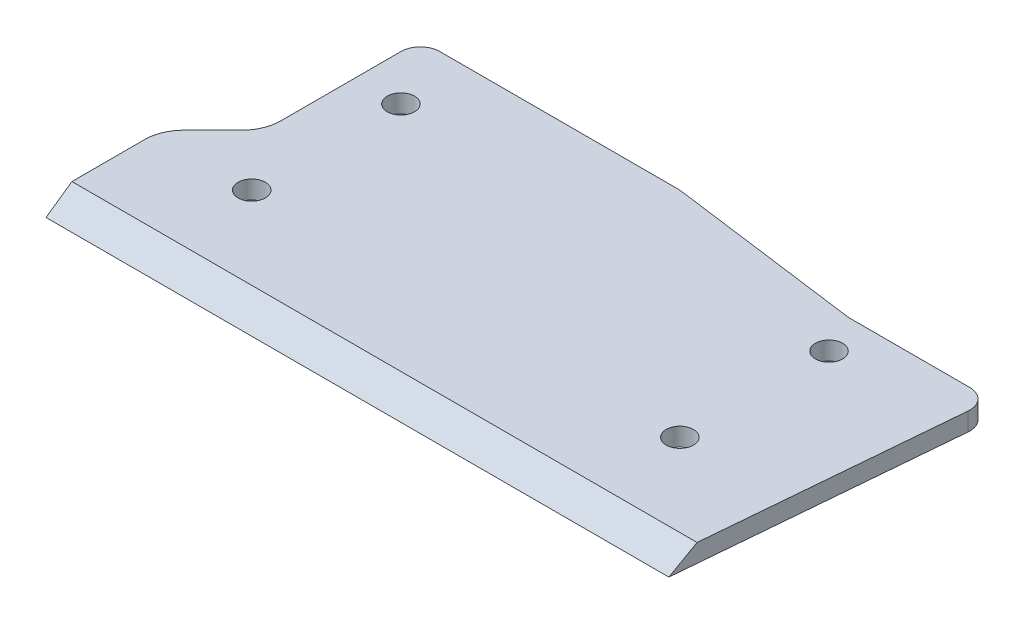
from build123d import *

# Parameters (mm, degrees)
BOSS_EXTRUDE1_DEPTH = 2.8
SKETCH2_R           = 2.1
CUT_EXTRUDE1_DEPTH  = 103.897230283
FILLET1_R           = 6
CHAMFER2_SIZE       = 4.28444402
CHAMFER2_SIZE_2     = 3
FILLET2_R           = 3


with BuildPart() as part:
    # Sketch1 → Boss-Extrude1 (new body)
    with BuildSketch(Plane(origin=(0, 0, 0), x_dir=(1, 0, 0), z_dir=(0, 1, 0))):
        Polygon((0, 4), (40, 4), (70, 0), (92, 0), (88, -46), (0, -46), (-8, -46), (-8, -28), (0, -20), align=None)
    extrude(amount=BOSS_EXTRUDE1_DEPTH)

    # Sketch2 → Cut-Extrude1 (cut, through all)
    with BuildSketch(Plane(origin=(0, 2.8, 0), x_dir=(1, 0, 0), z_dir=(0, 1, 0))):
        with Locations(Location((7, -6, 0), (0, 0, 270))):
            Circle(SKETCH2_R)
        with Locations(Location((7, -29, 0), (0, 0, 270))):
            Circle(SKETCH2_R)
        with Locations(Location((73, -6, 0), (0, 0, 270))):
            Circle(SKETCH2_R)
        with Locations(Location((73, -29, 0), (0, 0, 270))):
            Circle(SKETCH2_R)
    extrude(amount=-CUT_EXTRUDE1_DEPTH, mode=Mode.SUBTRACT)

    # Fillet1
    fillet1_edges = [part.edges().sort_by_distance(p)[0] for p in [
        (-8, 1.4, 28),
        (0, 1.4, 20),
    ]]
    fillet(fillet1_edges, radius=FILLET1_R)

    # Chamfer2
    # the kernel refuses this chamfer: 4.28444402, 3 mm, written as the material it takes off along each edge
    with BuildSketch(Plane(origin=(99.06480046, 2.8, 46), x_dir=(0, 0.02220967419845692, -0.99975333476413), z_dir=(-1, 0, 0))) as chamfer2_piece_1:
        Polygon((CHAMFER2_SIZE * 0.999753334817, CHAMFER2_SIZE * 0.0222096741996), (-CHAMFER2_SIZE_2 * 0.0222096741985, CHAMFER2_SIZE_2 * 0.999753334764), (0, 0), align=None)
    extrude(amount=118.12960092, mode=Mode.SUBTRACT)

    # Fillet2
    fillet2_edges = [part.edges().sort_by_distance(p)[0] for p in [
        (0, 1.4, -4),
        (92, 1.4, 0),
    ]]
    fillet(fillet2_edges, radius=FILLET2_R)


solid = part.part
